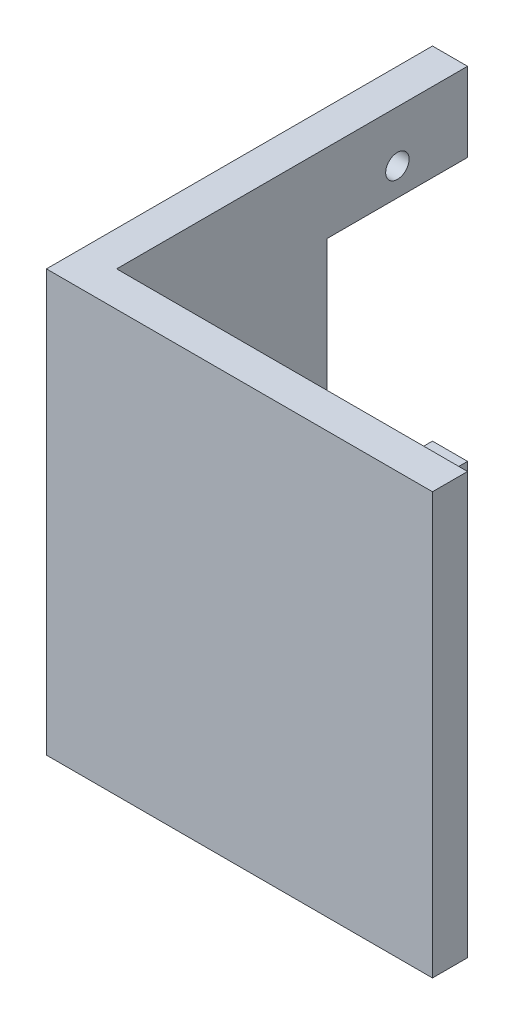
from build123d import *

# Parameters (mm, degrees)
EXTRUDE_THIN1_DEPTH = 18
SKETCH2_R           = 1
SKETCH2_W           = 12
SKETCH2_H           = 22.5
CUT_EXTRUDE1_DEPTH  = 47.086874487


with BuildPart() as part:
    # Sketch1 → Extrude-Thin1 (new, symmetric)
    with BuildSketch(Plane(origin=(0, 0, 0), x_dir=(1, 0, 0), z_dir=(0, 1, 0))):
        Polygon((0, 30), (0, 0), (30, 0), (30, -3), (-3, -3), (-3, 30), align=None)
    extrude(amount=EXTRUDE_THIN1_DEPTH, both=True)

    # Sketch2 → Cut-Extrude1 (cut, through all)
    with BuildSketch(Plane(origin=(0, 0, 0), x_dir=(0, 0, -1), z_dir=(1, 0, 0))):
        with Locations((24, -13.625)):
            Circle(SKETCH2_R)
        with Locations((24, 13.625)):
            Circle(SKETCH2_R)
        with Locations((24, 0)):
            Rectangle(SKETCH2_W, SKETCH2_H)
    extrude(amount=-CUT_EXTRUDE1_DEPTH, mode=Mode.SUBTRACT)


solid = part.part
